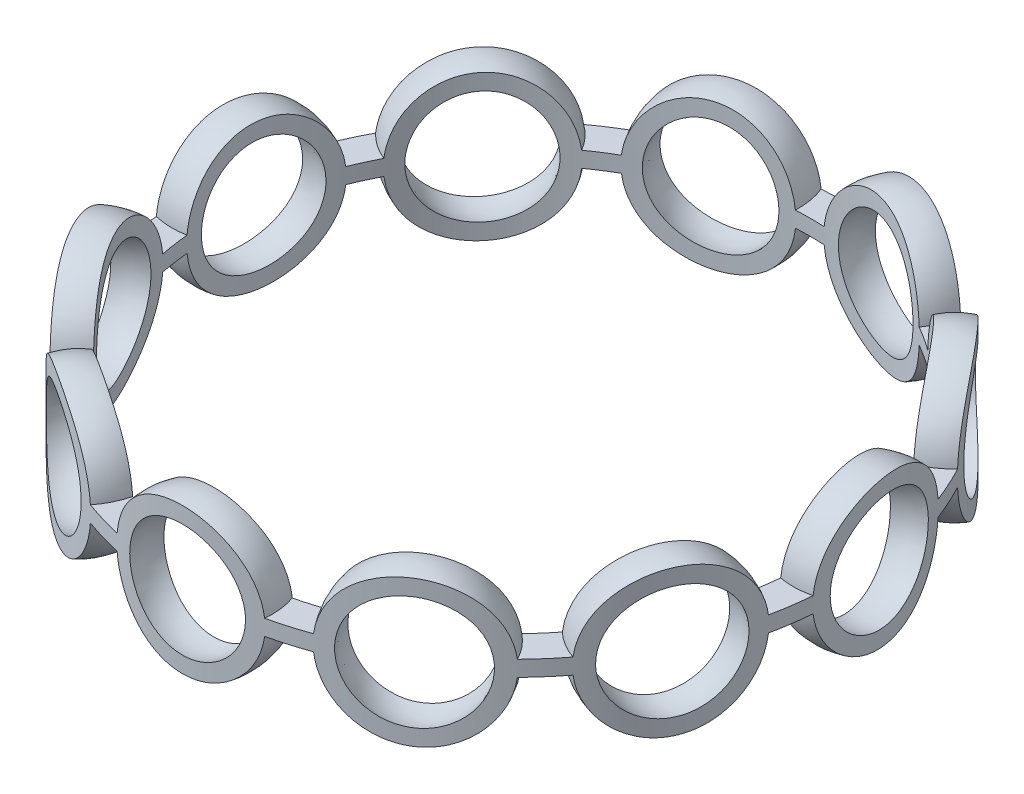
from build123d import *

# Parameters (mm, degrees)
SKETCH1_W          = 2
SKETCH1_H          = 1
CIRPATTERN10_COUNT = 11
SKETCH1_5_W        = 6.5
SKETCH1_5_H        = 15


with BuildPart() as part:
    # Sketch1 → Revolve1 (revolve)
    with BuildSketch(Plane(origin=(0, 0, 0), x_dir=(0, 0, -1), z_dir=(1, 0, 0))):
        with Locations((-20, 0)):
            Rectangle(SKETCH1_W, SKETCH1_H)
    revolve(axis=Axis((0, 0, 0), (0, 1, 0)))

    # Sketch4<3> → Revolve2 (revolve)
    with BuildSketch(Plane(origin=(0, 0, 0), x_dir=(0, 0, -1), z_dir=(1, 0, 0))):
        with BuildLine():
            Line((-20, 4.75), (-20, 3.75))
            ThreePointArc((-20, 3.75), (-16.25, 0), (-20, -3.75))
            Line((-20, -3.75), (-20, -4.75))
            ThreePointArc((-20, -4.75), (-15.25, 0), (-20, 4.75))
        make_face()
    revolve2 = revolve(axis=Axis((0, 3.75, 20), (0, -1, 0)))

    # Sketch4 → Cut-Revolve3 (revolve, cut)
    with BuildSketch(Plane(origin=(0, 0, 0), x_dir=(0, 0, -1), z_dir=(1, 0, 0))):
        with BuildLine():
            ThreePointArc((-20, -3.75), (-16.25, 0), (-20, 3.75))
            Line((-20, 3.75), (-20, -3.75))
        make_face()
    cut_revolve3 = revolve(axis=Axis((0, 3.75, 20), (0, -1, 0)), mode=Mode.SUBTRACT)

    # CirPattern10: Revolve2, Cut-Revolve3 ×11 about axis
    cirpattern10_axis = Axis((0, 0, 0), (0, -1, 0))
    add([revolve2.rotate(cirpattern10_axis, i * 360 / CIRPATTERN10_COUNT) for i in range(1, CIRPATTERN10_COUNT)])
    add([cut_revolve3.rotate(cirpattern10_axis, i * 360 / CIRPATTERN10_COUNT) for i in range(1, CIRPATTERN10_COUNT)], mode=Mode.SUBTRACT)

    # Sketch1<5> → Cut-Revolve5 (revolve, cut)
    with BuildSketch(Plane(origin=(0, 0, 0), x_dir=(0, 0, -1), z_dir=(1, 0, 0))):
        with Locations((-15.75, 0)):
            Rectangle(SKETCH1_5_W, SKETCH1_5_H)
        with Locations((-24.25, 0)):
            Rectangle(SKETCH1_5_W, SKETCH1_5_H)
    revolve(axis=Axis((0, 0, 0), (0, 1, 0)), mode=Mode.SUBTRACT)


solid = part.part
